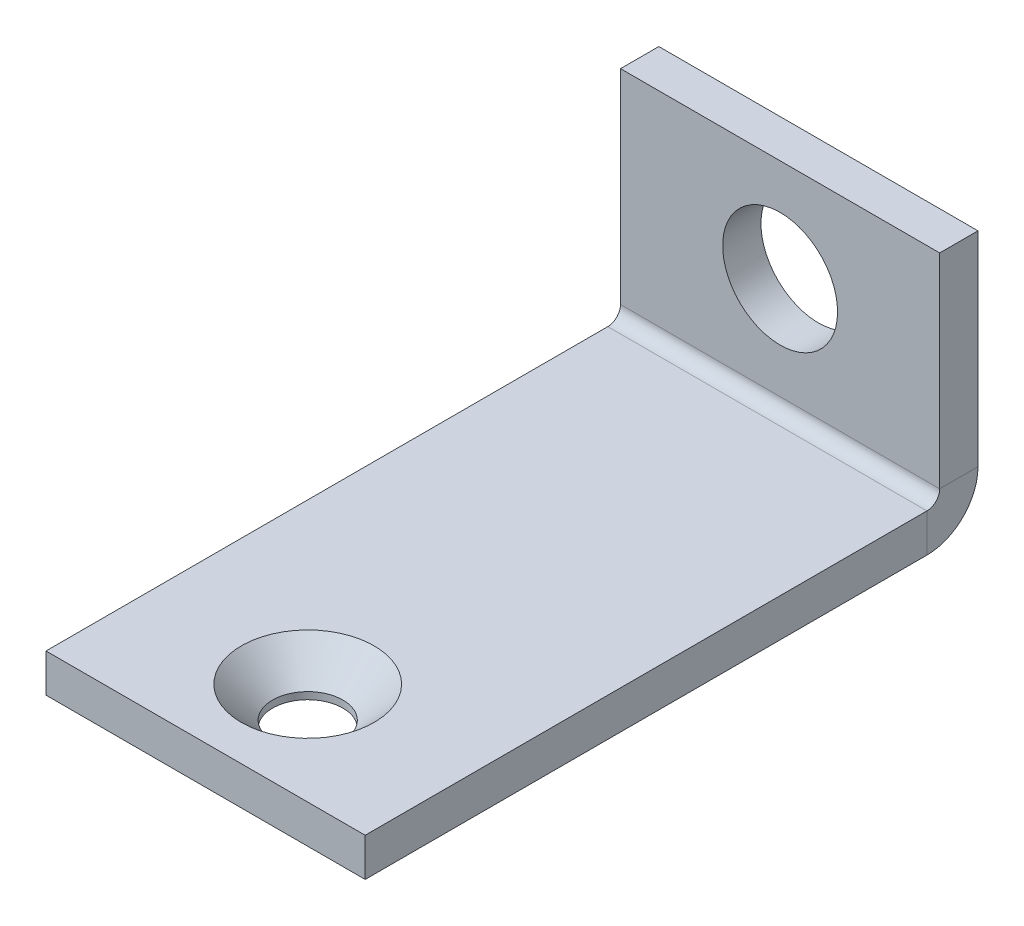
from build123d import *

# Parameters (mm, degrees)
T_LE_DE_BASE_PLI_E1_DEPTH = 25
D_GAGEMENT_M81_D          = 9


# Sheet-metal steps are written as plain solids
with BuildPart() as part:
    # Esquisse1 → Tôle de base pliée1 (new body)
    with BuildSketch(Plane(origin=(0, 0, 0), x_dir=(0, 0, -1), z_dir=(1, 0, 0))):
        with BuildLine():
            Line((0, 20), (0, 4))
            ThreePointArc((0, 4), (-1.171572875, 1.171572875), (-4, 0))
            Line((-4, 0), (-48, 0))
            Line((-48, 0), (-48, 3))
            Line((-48, 3), (-4, 3))
            ThreePointArc((-4, 3), (-3.292893219, 3.292893219), (-3, 4))
            Line((-3, 4), (-3, 20))
            Line((-3, 20), (0, 20))
        make_face()
    extrude(amount=T_LE_DE_BASE_PLI_E1_DEPTH)

    # Esquisse3 → Fraisage pour vis à tête fraisée M51 (revolve, cut)
    with BuildSketch(Plane(origin=(12.5, 3, 40), x_dir=(0, 0, 1), z_dir=(1, 0, 0))):
        Polygon((0, 0), (0, 3), (2.75, 3), (2.75, 2.45), (5.2, 0), align=None)
    revolve(axis=Axis((12.5, 9.35, 40), (0, -1, 0)), mode=Mode.SUBTRACT)

    # Dégagement M81 (through all)
    with Locations(Plane.XY.offset(3)):
        with Locations((12.5, 12)):
            Hole(D_GAGEMENT_M81_D / 2)


solid = part.part
